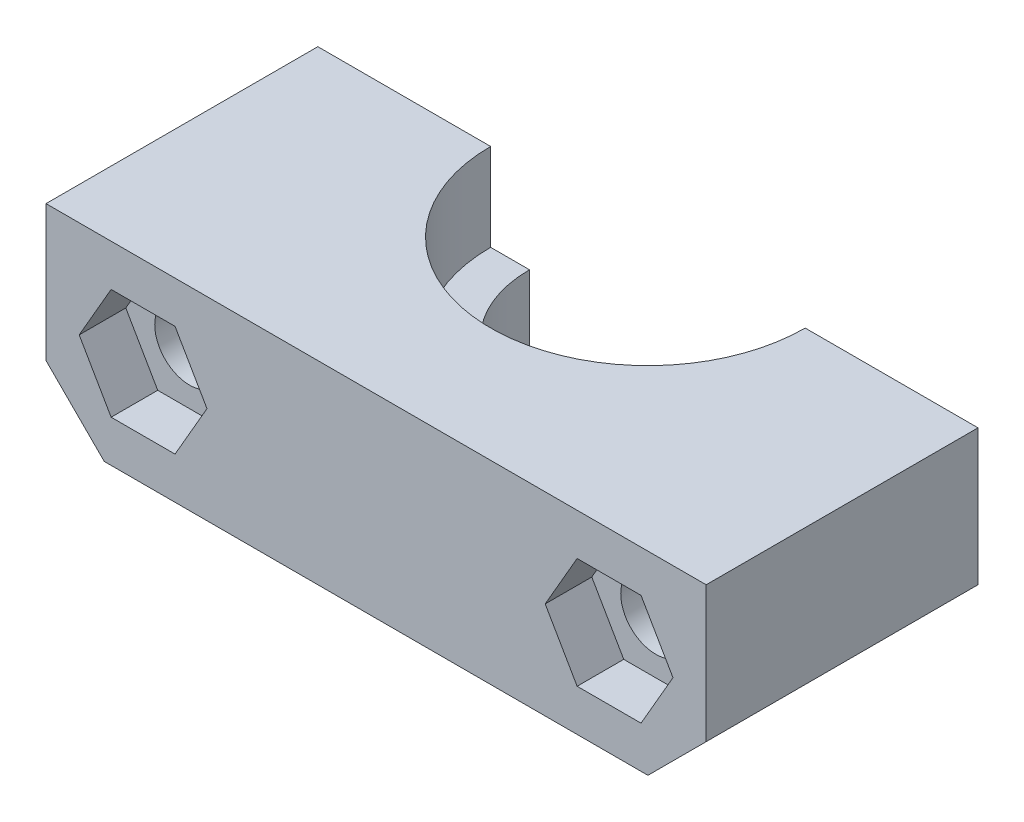
from build123d import *

# Parameters (mm, degrees)
SKETCH1_W               = 34
SKETCH1_H               = 14
BOSS_EXTRUDE1_DEPTH     = 10
SKETCH2_R               = 8.1
CUT_EXTRUDE1_DEPTH      = 4.5
CUT_EXTRUDE2_DEPTH      = 39.105117767
CUT_EXTRUDE2_DEPTH_BACK = 39.105117767
SKETCH4_R               = 6.1
CUT_EXTRUDE3_DEPTH      = 39.105117767
CUT_EXTRUDE3_DEPTH_BACK = 39.105117767
SKETCH5_R               = 1.8
CUT_EXTRUDE4_DEPTH      = 2.4
CHAMFER1_SIZE           = 3


with BuildPart() as part:
    # Sketch1 → Boss-Extrude1 (new body)
    with BuildSketch(Plane(origin=(0, 0, 0), x_dir=(1, 0, 0), z_dir=(0, 1, 0))):
        with Locations((17, 7)):
            Rectangle(SKETCH1_W, SKETCH1_H)
    extrude(amount=BOSS_EXTRUDE1_DEPTH)

    # Sketch2 → Cut-Extrude1 (cut)
    with BuildSketch(Plane(origin=(0, 10, 0), x_dir=(1, 0, 0), z_dir=(0, 1, 0))):
        with Locations((17, 14)):
            Circle(SKETCH2_R)
    extrude(amount=-CUT_EXTRUDE1_DEPTH, mode=Mode.SUBTRACT)

    # Sketch4 → Cut-Extrude2 (cut, two sides: drawn at the far end of the back side and taken through both)
    with BuildSketch(Plane(origin=(0, 10, 0), x_dir=(1, 0, 0), z_dir=(0, 1, 0)).offset(-CUT_EXTRUDE2_DEPTH_BACK)):
        with Locations((17, 14)):
            Circle(SKETCH4_R)
    extrude(amount=CUT_EXTRUDE2_DEPTH + CUT_EXTRUDE2_DEPTH_BACK, mode=Mode.SUBTRACT)

    # Sketch5 → Cut-Extrude3 (cut, two sides: drawn at the far end of the back side and taken through both)
    with BuildSketch(Plane(origin=(0, 0, -14), x_dir=(-1, 0, 0), z_dir=(0, 0, -1)).offset(-CUT_EXTRUDE3_DEPTH_BACK)):
        with Locations((-29, 5)):
            Circle(SKETCH5_R)
        with Locations((-5, 5)):
            Circle(SKETCH5_R)
    extrude(amount=CUT_EXTRUDE3_DEPTH + CUT_EXTRUDE3_DEPTH_BACK, mode=Mode.SUBTRACT)

    # Sketch6 → Cut-Extrude4 (cut)
    with BuildSketch(Plane.XY):
        Polygon((8.290896534, 5), (6.645448267, 7.85), (3.354551733, 7.85), (1.709103466, 5), (3.354551733, 2.15), (6.645448267, 2.15), align=None)
        Polygon((25.709103466, 5), (27.354551733, 2.15), (30.645448267, 2.15), (32.290896534, 5), (30.645448267, 7.85), (27.354551733, 7.85), align=None)
    extrude(amount=-CUT_EXTRUDE4_DEPTH, mode=Mode.SUBTRACT)

    # Chamfer1
    chamfer1_edges = [part.edges().sort_by_distance(p)[0] for p in [
        (0, 0, -7),
        (34, 0, -7),
    ]]
    chamfer(chamfer1_edges, length=CHAMFER1_SIZE)


solid = part.part
